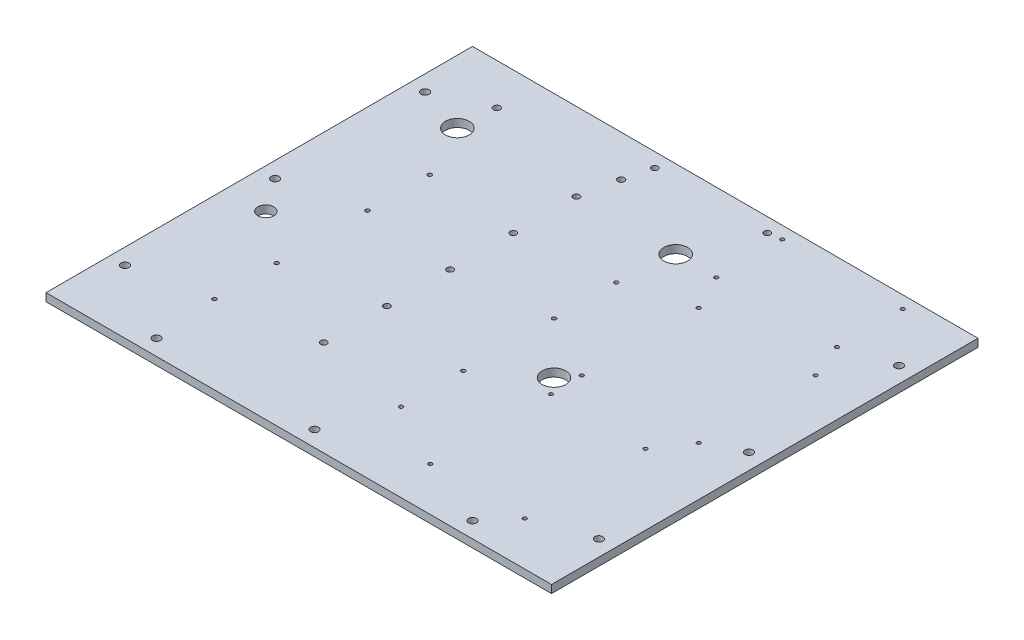
from build123d import *

# Parameters (mm, degrees)
SKETCH1_W           = 406.4
SKETCH1_H           = 342.9
BOSS_EXTRUDE1_DEPTH = 6.35
SKETCH3_R           = 3.175
CUT_EXTRUDE1_DEPTH  = 532.772218624
SKETCH4_R           = 9.525
SKETCH4_R_2         = 1.5875
SKETCH4_R_3         = 2.5
SKETCH4_R_4         = 2.667
SKETCH4_R_5         = 2.54
SKETCH4_R_6         = 1.5
SKETCH4_R_7         = 6.35
CUT_EXTRUDE2_DEPTH  = 532.772218624


with BuildPart() as part:
    # Sketch1 → Boss-Extrude1 (new body)
    with BuildSketch(Plane(origin=(0, 0, 0), x_dir=(1, 0, 0), z_dir=(0, 1, 0))):
        with Locations((203.2, 171.45)):
            Rectangle(SKETCH1_W, SKETCH1_H)
    extrude(amount=BOSS_EXTRUDE1_DEPTH)

    # Sketch3 → Cut-Extrude1 (cut, through all)
    with BuildSketch(Plane(origin=(0, 6.35, 0), x_dir=(1, 0, 0), z_dir=(0, 1, 0))):
        with Locations((203.2, 12.7)):
            Circle(SKETCH3_R)
        with Locations((330.2, 12.7)):
            Circle(SKETCH3_R)
        with Locations((76.2, 12.7)):
            Circle(SKETCH3_R)
        with Locations((12.7, 171.45)):
            Circle(SKETCH3_R)
        with Locations((393.7, 171.45)):
            Circle(SKETCH3_R)
        with Locations((12.7, 292.1)):
            Circle(SKETCH3_R)
        with Locations((12.7, 50.8)):
            Circle(SKETCH3_R)
        with Locations((393.7, 50.8)):
            Circle(SKETCH3_R)
        with Locations((393.7, 292.1)):
            Circle(SKETCH3_R)
    extrude(amount=-CUT_EXTRUDE1_DEPTH, mode=Mode.SUBTRACT)

    # Sketch4 → Cut-Extrude2 (cut, through all)
    with BuildSketch(Plane(origin=(0, 6.35, 0), x_dir=(1, 0, 0), z_dir=(0, 1, 0))):
        with Locations((226.4, 279.9)):
            Circle(SKETCH4_R)
        with Locations((50.8, 279.9)):
            Circle(SKETCH4_R)
        with Locations((222.1748, 63.265)):
            Circle(SKETCH4_R_2)
        with Locations((222.1748, 113.265)):
            Circle(SKETCH4_R_2)
        with Locations((72.1748, 113.265)):
            Circle(SKETCH4_R_2)
        with Locations((72.1748, 63.265)):
            Circle(SKETCH4_R_2)
        with Locations((72.1748, 186.295)):
            Circle(SKETCH4_R_2)
        with Locations((72.1748, 236.295)):
            Circle(SKETCH4_R_2)
        with Locations((222.1748, 236.295)):
            Circle(SKETCH4_R_2)
        with Locations((222.1748, 186.295)):
            Circle(SKETCH4_R_2)
        with Locations((248.4501, 331.47)):
            Circle(SKETCH4_R_3)
        with Locations((157.9499, 331.47)):
            Circle(SKETCH4_R_3)
        with Locations((52.5398, 309.88)):
            Circle(SKETCH4_R_4)
        with Locations((152.5398, 309.88)):
            Circle(SKETCH4_R_4)
        with Locations((146.3548, 178.4985)):
            Circle(SKETCH4_R_5)
        with Locations((146.3548, 127.6985)):
            Circle(SKETCH4_R_5)
        with Locations((146.3548, 76.8985)):
            Circle(SKETCH4_R_5)
        with Locations((146.3548, 280.0985)):
            Circle(SKETCH4_R_5)
        with Locations((146.3548, 229.2985)):
            Circle(SKETCH4_R_5)
        with Locations((355.833, 333.05)):
            Circle(SKETCH4_R_6)
        with Locations((258.833, 333.05)):
            Circle(SKETCH4_R_6)
        with Locations((355.833, 280.05)):
            Circle(SKETCH4_R_6)
        with Locations((258.833, 280.05)):
            Circle(SKETCH4_R_6)
        with Locations((366.9502, 251.78)):
            Circle(SKETCH4_R_6)
        with Locations((272.9502, 251.78)):
            Circle(SKETCH4_R_6)
        with Locations((366.9502, 157.78)):
            Circle(SKETCH4_R_6)
        with Locations((272.9502, 157.78)):
            Circle(SKETCH4_R_6)
        with Locations((349.7002, 35.25)):
            Circle(SKETCH4_R_6)
        with Locations((349.7002, 132.25)):
            Circle(SKETCH4_R_6)
        with Locations((273.7002, 132.25)):
            Circle(SKETCH4_R_6)
        with Locations((273.7002, 35.25)):
            Circle(SKETCH4_R_6)
        with Locations((263.4, 145)):
            Circle(SKETCH4_R)
        with Locations((31.75, 145)):
            Circle(SKETCH4_R_7)
    extrude(amount=-CUT_EXTRUDE2_DEPTH, mode=Mode.SUBTRACT)


solid = part.part
